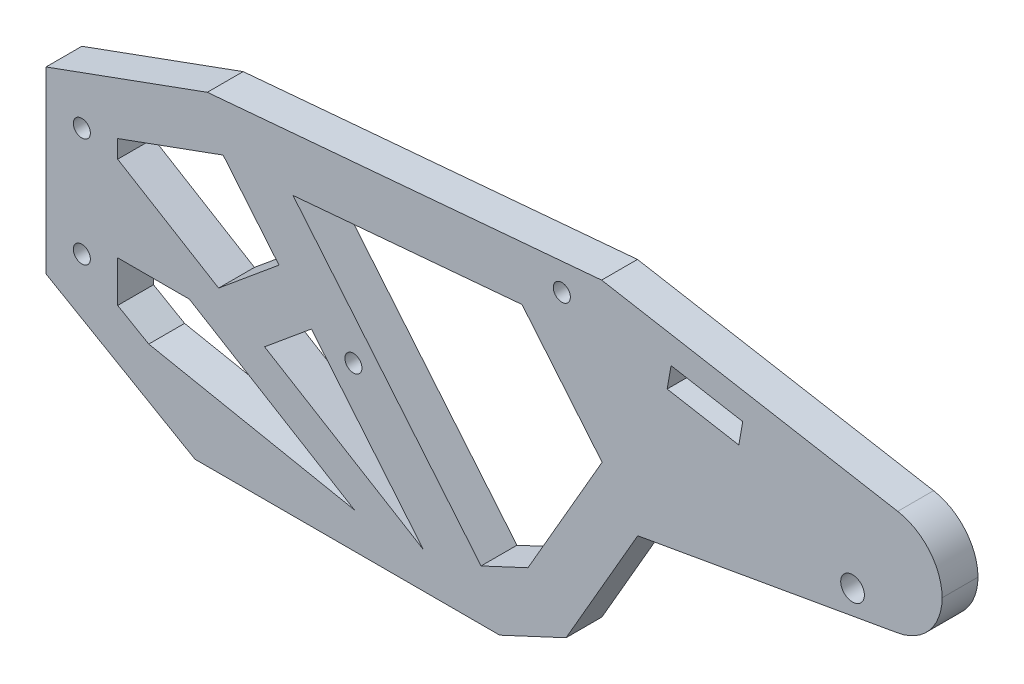
from build123d import *

# Parameters (mm, degrees)
ESQUISSE1_W                             = 250
ESQUISSE1_H                             = 100
BOSS_EXTRU_1_DEPTH                      = 10
ESQUISSE2_OUTSIDE_W                     = 305.888
ESQUISSE2_OUTSIDE_H                     = 155.888
ENL_V_MAT_EXTRU_1_DEPTH                 = 270.443871706
ENL_V_MAT_EXTRU_2_DEPTH                 = 270.443871706
CONG_1_R                                = 15
ESQUISSE4_R                             = 3.305
ENL_V_MAT_EXTRU_3_DEPTH                 = 270.443640324
PER_AGE_POUR_CROUS_AUTO_BLOQUANTS_300_D = 4.7625
PER_AGE_POUR_CROUS_AUTO_BLOQUANTS_3_2_D = 4.7625
ENL_V_MAT_EXTRU_4_DEPTH                 = 10


with BuildPart() as part:
    # Esquisse1 → Boss.-Extru.1 (new body)
    with BuildSketch(Plane.XY):
        with Locations((125, 50)):
            Rectangle(ESQUISSE1_W, ESQUISSE1_H)
    extrude(amount=BOSS_EXTRU_1_DEPTH)

    # Esquisse2 outside → Enlèv. mat.-Extru.1 (cut, through all)
    with BuildSketch(Plane.XY.offset(10)):
        with Locations((125, 50)):
            Rectangle(ESQUISSE2_OUTSIDE_W, ESQUISSE2_OUTSIDE_H)
        Polygon((250, 83.248936833), (155, 100), (45, 90.376247012), (0, 73.99758647), (0, 23.99758647), (41.565039025, 0), (126.565039025, 0), (145.081949739, 8.634577271), (165.081949739, 43.275593423), (250, 58.248936833), align=None, mode=Mode.SUBTRACT)
    extrude(amount=-ENL_V_MAT_EXTRU_1_DEPTH, mode=Mode.SUBTRACT)

    # Esquisse3 → Enlèv. mat.-Extru.2 (cut, through all)
    with BuildSketch(Plane.XY.offset(10)):
        Polygon((134.456309599, 20.230428685), (155.141265019, 56.057822426), (132.800938883, 83.000536248), (68.90430085, 77.410304783), (121.374682449, 14.130365764), align=None)
        Polygon((105.313706387, 10), (74.046358719, 47.708813875), (60.975248723, 36.870527049), align=None)
        Polygon((20, 26.375291272), (20, 37.889147432), (40, 37.889147432), (86.019260451, 10), (28.660254038, 21.375291272), align=None)
        Polygon((20, 61.702841638), (48.147118965, 44.644785014), (65, 58.618836074), (49.418513209, 77.410304783), (20, 66.702841638), align=None)
    extrude(amount=-ENL_V_MAT_EXTRU_2_DEPTH, mode=Mode.SUBTRACT)

    # Congé1
    # the kernel refuses this fillet: 15 mm, written as the material it takes off along each edge
    with BuildSketch(Plane(origin=(250, 83.248936833, 41.466236169), x_dir=(-0.9848077530122094, 0.17364817766692334, 0), z_dir=(0, 0, -1))) as cong_1_piece_1:
        with BuildLine():
            CenterArc((CONG_1_R * 0.839099631177, -CONG_1_R), CONG_1_R, 90, 80)
            Line((-CONG_1_R * 0.145708121835, -CONG_1_R * 0.826351822333), (0, 0))
            Line((0, 0), (CONG_1_R * 0.839099631177, 0))
        make_face()
    extrude(amount=72.932472338, mode=Mode.SUBTRACT)
    with BuildSketch(Plane(origin=(250, 58.248936833, 41.466236169), x_dir=(-0.984807753012208, -0.17364817766693091, 0), z_dir=(0, 0, -1))) as cong_1_piece_2:
        with BuildLine():
            CenterArc((CONG_1_R * 0.839099631177, CONG_1_R), CONG_1_R, 190, 80)
            Line((-CONG_1_R * 0.145708121835, CONG_1_R * 0.826351822333), (0, 0))
            Line((0, 0), (CONG_1_R * 0.839099631177, 0))
        make_face()
    extrude(amount=72.932472338, mode=Mode.SUBTRACT)

    # Esquisse4 → Enlèv. mat.-Extru.3 (cut, through all)
    with BuildSketch(Plane.XY.offset(10)):
        with Locations((224.999750621, 60.537155323)):
            Circle(ESQUISSE4_R)
    extrude(amount=-ENL_V_MAT_EXTRU_3_DEPTH, mode=Mode.SUBTRACT)

    # Per_age pour _crous auto-bloquants 300 (through all)
    with Locations(Plane.XY.offset(10)):
        with Locations((85.764023291, 45.327215553), (143.900469441, 91.500268124)):
            Hole(PER_AGE_POUR_CROUS_AUTO_BLOQUANTS_300_D / 2)

    # Per_age pour _crous auto-bloquants 3 2 (through all)
    with Locations(Plane.XY.offset(10)):
        with Locations((10, 64.202841638), (10, 33.792331302)):
            Hole(PER_AGE_POUR_CROUS_AUTO_BLOQUANTS_3_2_D / 2)

    # Esquisse10 → Enlèv. mat.-Extru.4 (cut)
    with BuildSketch(Plane.XY.offset(10)):
        Polygon((174.373076709, 89.029229885), (173.279093189, 82.824941041), (193.270690575, 79.299883034), (194.364674095, 85.504171878), align=None)
    extrude(amount=-ENL_V_MAT_EXTRU_4_DEPTH, mode=Mode.SUBTRACT)


solid = part.part
